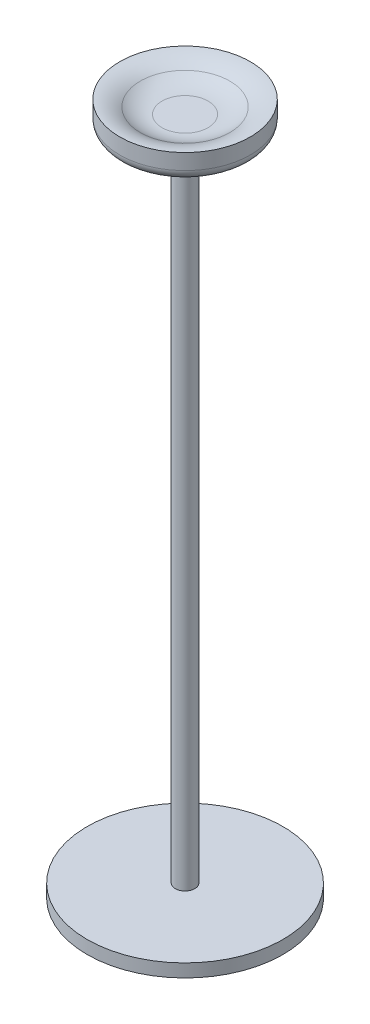
from build123d import *

# Parameters (mm, degrees)
SKETCH1_R           = 75
BOSS_EXTRUDE1_DEPTH = 10
SKETCH2_R           = 7.5
BOSS_EXTRUDE2_DEPTH = 500
SKETCH3_R           = 50
BOSS_EXTRUDE3_DEPTH = 20
FILLET1_R           = 8
SKETCH4_R           = 40.009187759
CUT_EXTRUDE1_DEPTH  = 10
FILLET3_R           = 30
FILLET4_R           = 30


with BuildPart() as part:
    # Sketch1 → Boss-Extrude1 (new body)
    with BuildSketch(Plane(origin=(0, 0, 0), x_dir=(1, 0, 0), z_dir=(0, 1, 0))):
        with Locations(Location((0, 0, 0), (0, 0, 270))):
            Circle(SKETCH1_R)
    extrude(amount=BOSS_EXTRUDE1_DEPTH)

    # Sketch2 → Boss-Extrude2 (add)
    with BuildSketch(Plane(origin=(0, 10, 0), x_dir=(1, 0, 0), z_dir=(0, 1, 0))):
        with Locations(Location((0, 0, 0), (0, 0, 270))):
            Circle(SKETCH2_R)
    extrude(amount=BOSS_EXTRUDE2_DEPTH)

    # Sketch3 → Boss-Extrude3 (add)
    with BuildSketch(Plane(origin=(0, 510, 0), x_dir=(1, 0, 0), z_dir=(0, 1, 0))):
        with Locations(Location((0, 0, 0), (0, 0, 270))):
            Circle(SKETCH3_R)
    extrude(amount=BOSS_EXTRUDE3_DEPTH)

    # Fillet1
    fillet1_edges = [part.edges().sort_by_distance(p)[0] for p in [
        (0, 510, -7.5),
        (0, 510, -50),
    ]]
    fillet(fillet1_edges, radius=FILLET1_R)

    # Sketch4 → Cut-Extrude1 (cut)
    with BuildSketch(Plane(origin=(0, 530, 0), x_dir=(1, 0, 0), z_dir=(0, 1, 0))):
        with Locations(Location((0, 0, 0), (0, 0, 270))):
            Circle(SKETCH4_R)
    extrude(amount=-CUT_EXTRUDE1_DEPTH, mode=Mode.SUBTRACT)

    # Fillet3
    # the kernel refuses this fillet: 30 mm, written as the material it adds along each edge
    with BuildSketch(Plane(origin=(0, 520, 0), x_dir=(0, 0, 1), z_dir=(-1, 0, 0))) as fillet3_piece_1:
        with BuildLine():
            CenterArc((17.648507984, 30), FILLET3_R, 270, 48.189685104)
            Line((17.648507984, 0), (17.648507984, -0.6))
            Line((17.648507984, -0.6), (40.009187759, -0.6))
            Line((40.009187759, -0.6), (40.609187759, 0))
            ThreePointArc((40.609187759, 0), (40.609187759, 5), (40.456401354, 9.6))
            Line((40.456401354, 9.6), (40.009187759, 10))
        make_face()
    revolve(axis=Axis((0, 520, 0), (0, 1, 0)))

    # Fillet4
    # the kernel refuses this fillet: 30 mm, written as the material it takes off along each edge
    with BuildSketch(Plane(origin=(0, 530, 0), x_dir=(0, 0, 1), z_dir=(-1, 0, 0))) as fillet4_piece_1:
        with BuildLine():
            CenterArc((50.832151794, -29.988456502), FILLET4_R, 91.589496733, 31.987749571)
            Line((50, 0), (49.983356964, 0.59976913))
            ThreePointArc((49.983356964, 0.59976913), (45.004593879, 0.6), (40.009187759, 0.6))
            Line((40.009187759, 0.6), (39.561974163, 0.4))
            ThreePointArc((39.561974163, 0.4), (36.891474301, -2.227646014), (33.908493451, -4.494343686))
            Line((33.908493451, -4.494343686), (34.240329889, -4.994228251))
        make_face()
    revolve(axis=Axis((0, 530, 0), (0, 1, 0)), mode=Mode.SUBTRACT)


solid = part.part
